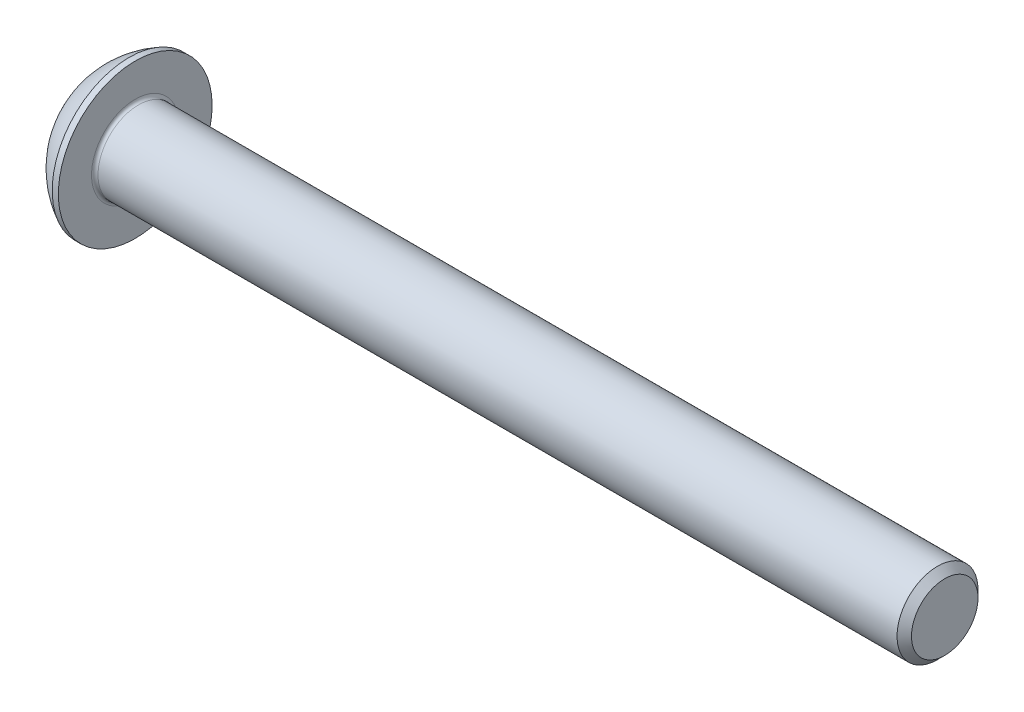
from build123d import *

# Parameters (mm, degrees)
FILLET_1_R  = 0.2
HEX_2_DEPTH = 1.56


with BuildPart() as part:
    # Эскиз1 → Body (revolve)
    with BuildSketch(Plane.XY):
        with BuildLine():
            Line((0, 2.375), (0, 0))
            Line((0, 0), (52.75, 0))
            Line((52.75, 0), (52.75, 2.055))
            Line((52.75, 2.055), (52.305, 2.5))
            Line((52.305, 2.5), (2.75, 2.5))
            Line((2.75, 2.5), (2.75, 4.75))
            Line((2.75, 4.75), (2.370164642, 4.75))
            ThreePointArc((2.370164642, 4.75), (0.992749859, 3.754440885), (0, 2.375))
        make_face()
    revolve(axis=Axis((-3.643489966, 0, 0), (-1, 0, 0)))

    # Скругление1
    fillet_1_edges = [part.edges().sort_by_distance(p)[0] for p in [
        (2.75, -2.5, 0),
    ]]
    fillet(fillet_1_edges, radius=FILLET_1_R)

    # Эскиз2 → Вырез-Повернуть1 (revolve, cut)
    with BuildSketch(Plane.XY):
        Polygon((0, 0), (0, 1.5), (1.56, 1.5), (2.426025404, 0), align=None)
    revolve(axis=Axis((2.426025404, 0, 0), (-1, 0, 0)), mode=Mode.SUBTRACT)

    # Эскиз3 → Hex 2 (cut)
    with BuildSketch(Plane.ZY):
        Polygon((-1.5, -0.866025404), (0, -1.732050808), (1.5, -0.866025404), (1.5, 0.866025404), (0, 1.732050808), (-1.5, 0.866025404), align=None)
    extrude(amount=-HEX_2_DEPTH, mode=Mode.SUBTRACT)


solid = part.part
